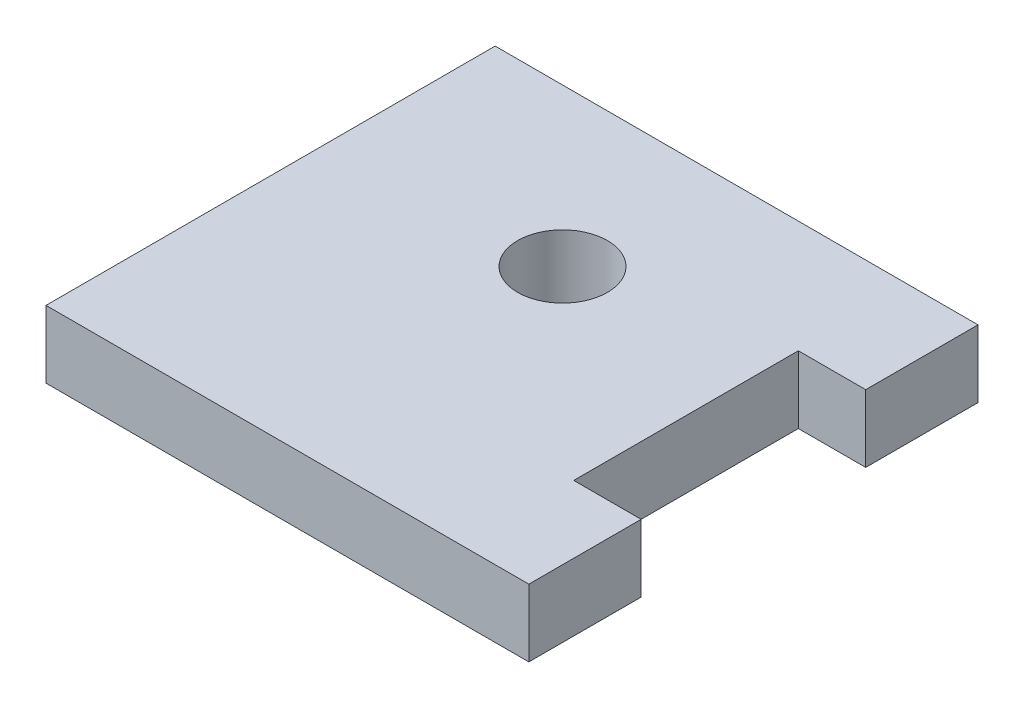
from build123d import *

# Parameters (mm, degrees)
SKETCH1_R           = 2
BOSS_EXTRUDE1_DEPTH = 3


with BuildPart() as part:
    # Sketch1 → Boss-Extrude1 (new body)
    with BuildSketch(Plane(origin=(0, 0, 0), x_dir=(1, 0, 0), z_dir=(0, 1, 0))):
        Polygon((0, 0), (21.5, 0), (21.5, 5), (18.5, 5), (18.5, 15), (21.5, 15), (21.5, 20), (0, 20), align=None)
        with Locations((10, 13)):
            Circle(SKETCH1_R, mode=Mode.SUBTRACT)
    extrude(amount=BOSS_EXTRUDE1_DEPTH)


solid = part.part
